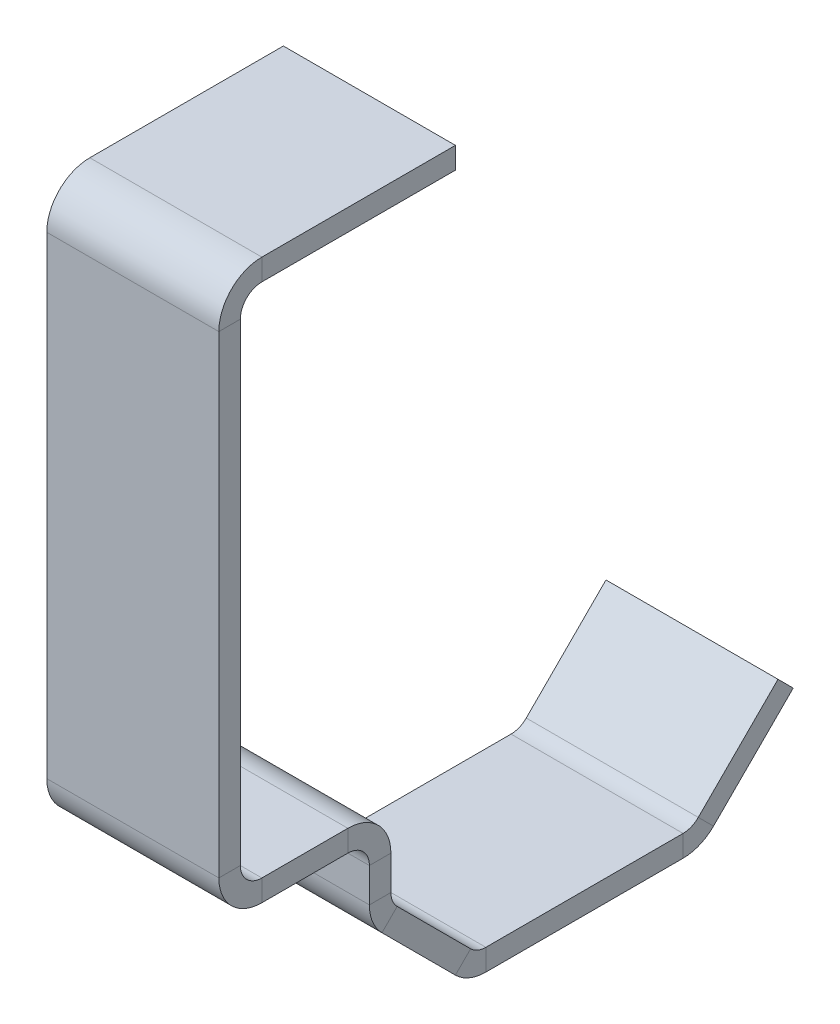
from build123d import *

# Parameters (mm, degrees)
BASE_FLANGE1_DEPTH = 2


# Sheet-metal steps are written as plain solids
with BuildPart() as part:
    # Sketch1 → Base-Flange1 (new, symmetric)
    with BuildSketch(Plane(origin=(0, 0, 0), x_dir=(0, 0, -1), z_dir=(1, 0, 0))):
        with BuildLine():
            Line((-3, 16), (-7.5, 16))
            ThreePointArc((-7.5, 16), (-7.853553391, 15.853553391), (-8, 15.5))
            Line((-8, 15.5), (-8, 4.5))
            ThreePointArc((-8, 4.5), (-7.853553391, 4.146446609), (-7.5, 4))
            Line((-7.5, 4), (-5.5, 4))
            ThreePointArc((-5.5, 4), (-4.792893219, 3.707106781), (-4.5, 3))
            Line((-4.5, 3), (-4.5, 2.207106781))
            ThreePointArc((-4.5, 2.207106781), (-4.461939766, 2.015765065), (-4.353553391, 1.853553391))
            Line((-4.353553391, 1.853553391), (-2.646446609, 0.146446609))
            ThreePointArc((-2.646446609, 0.146446609), (-2.484234935, 0.038060234), (-2.292893219, 0))
            Line((-2.292893219, 0), (2.292893219, 0))
            ThreePointArc((2.292893219, 0), (2.484234935, 0.038060234), (2.646446609, 0.146446609))
            Line((2.646446609, 0.146446609), (4.5, 2))
            Line((4.5, 2), (4.853553391, 1.646446609))
            Line((4.853553391, 1.646446609), (3, -0.207106781))
            ThreePointArc((3, -0.207106781), (2.675576651, -0.423879533), (2.292893219, -0.5))
            Line((2.292893219, -0.5), (-2.292893219, -0.5))
            ThreePointArc((-2.292893219, -0.5), (-2.675576651, -0.423879533), (-3, -0.207106781))
            Line((-3, -0.207106781), (-4.707106781, 1.5))
            ThreePointArc((-4.707106781, 1.5), (-4.923879533, 1.824423349), (-5, 2.207106781))
            Line((-5, 2.207106781), (-5, 3))
            ThreePointArc((-5, 3), (-5.146446609, 3.353553391), (-5.5, 3.5))
            Line((-5.5, 3.5), (-7.5, 3.5))
            ThreePointArc((-7.5, 3.5), (-8.207106781, 3.792893219), (-8.5, 4.5))
            Line((-8.5, 4.5), (-8.5, 15.5))
            ThreePointArc((-8.5, 15.5), (-8.207106781, 16.207106781), (-7.5, 16.5))
            Line((-7.5, 16.5), (-3, 16.5))
            Line((-3, 16.5), (-3, 16))
        make_face()
    extrude(amount=BASE_FLANGE1_DEPTH, both=True)


solid = part.part
